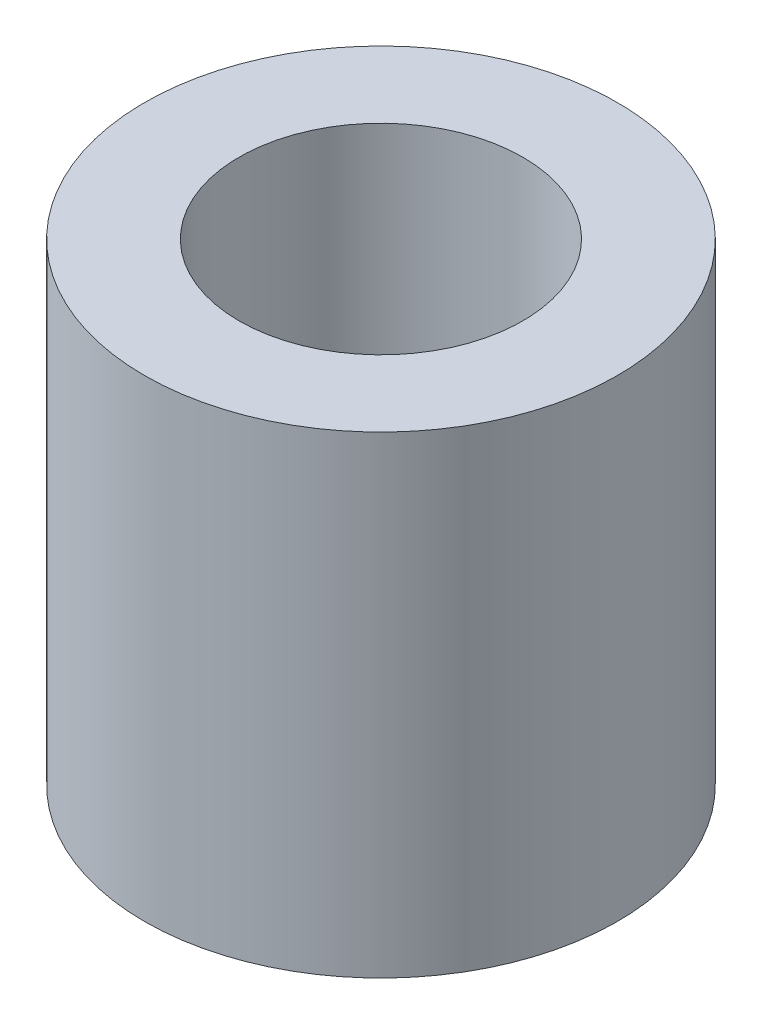
from build123d import *

# Parameters (mm, degrees)
ESQUISSE1_R      = 2.5
ESQUISSE1_R_2    = 1.5
EXTRUSION1_DEPTH = 2.5


with BuildPart() as part:
    # Esquisse1 → Extrusion1 (new, symmetric)
    with BuildSketch(Plane(origin=(0, 0, 0), x_dir=(1, 0, 0), z_dir=(0, 1, 0))):
        Circle(ESQUISSE1_R)
        Circle(ESQUISSE1_R_2, mode=Mode.SUBTRACT)
    extrude(amount=EXTRUSION1_DEPTH, both=True)


solid = part.part
